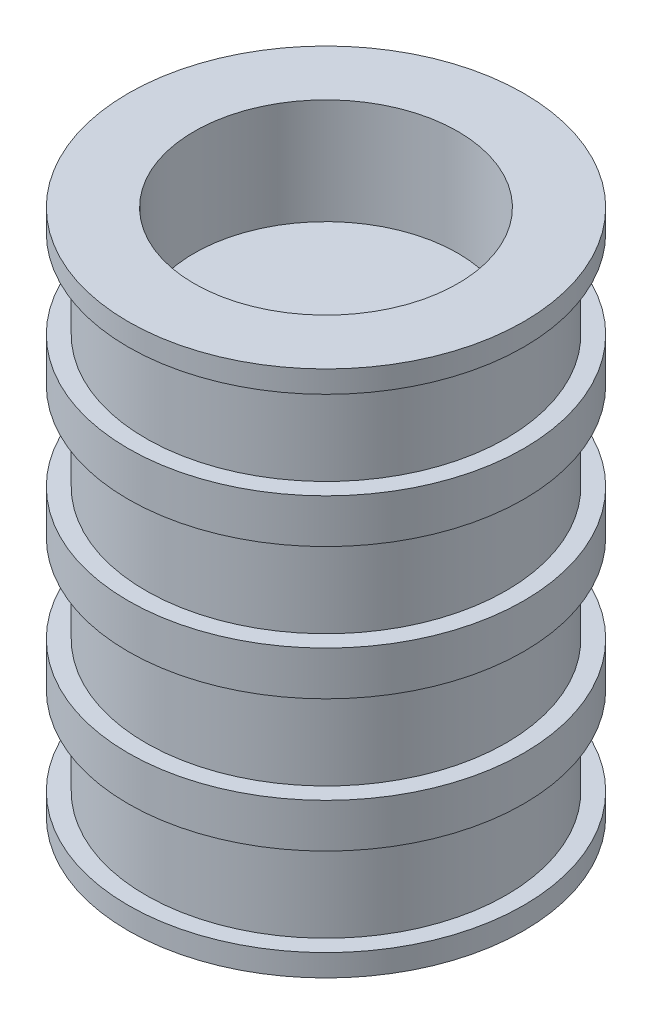
from build123d import *

# Parameters (mm, degrees)
SKETCH1_R           = 22.5
BOSS_EXTRUDE1_DEPTH = 60
SKETCH2_R           = 15
CUT_EXTRUDE1_DEPTH  = 12
SKETCH6_W           = 2
SKETCH6_H           = 10


with BuildPart() as part:
    # Sketch1 → Boss-Extrude1 (new body)
    with BuildSketch(Plane(origin=(0, 0, 0), x_dir=(1, 0, 0), z_dir=(0, 1, 0))):
        Circle(SKETCH1_R)
    extrude(amount=BOSS_EXTRUDE1_DEPTH)

    # Sketch2 → Cut-Extrude1 (cut)
    with BuildSketch(Plane(origin=(0, 60, 0), x_dir=(1, 0, 0), z_dir=(0, 1, 0))):
        Circle(SKETCH2_R)
    extrude(amount=-CUT_EXTRUDE1_DEPTH, mode=Mode.SUBTRACT)

    # Sketch6 → Cut-Revolve1 (revolve, cut)
    with BuildSketch(Plane.XY):
        with Locations((-21.5, 37.5)):
            Rectangle(SKETCH6_W, SKETCH6_H)
        with Locations((-21.5, 52.5)):
            Rectangle(SKETCH6_W, SKETCH6_H)
        with Locations((-21.5, 22.5)):
            Rectangle(SKETCH6_W, SKETCH6_H)
        with Locations((-21.5, 7.5)):
            Rectangle(SKETCH6_W, SKETCH6_H)
    revolve(axis=Axis((0, 0, 0), (0, 1, 0)), mode=Mode.SUBTRACT)


solid = part.part
